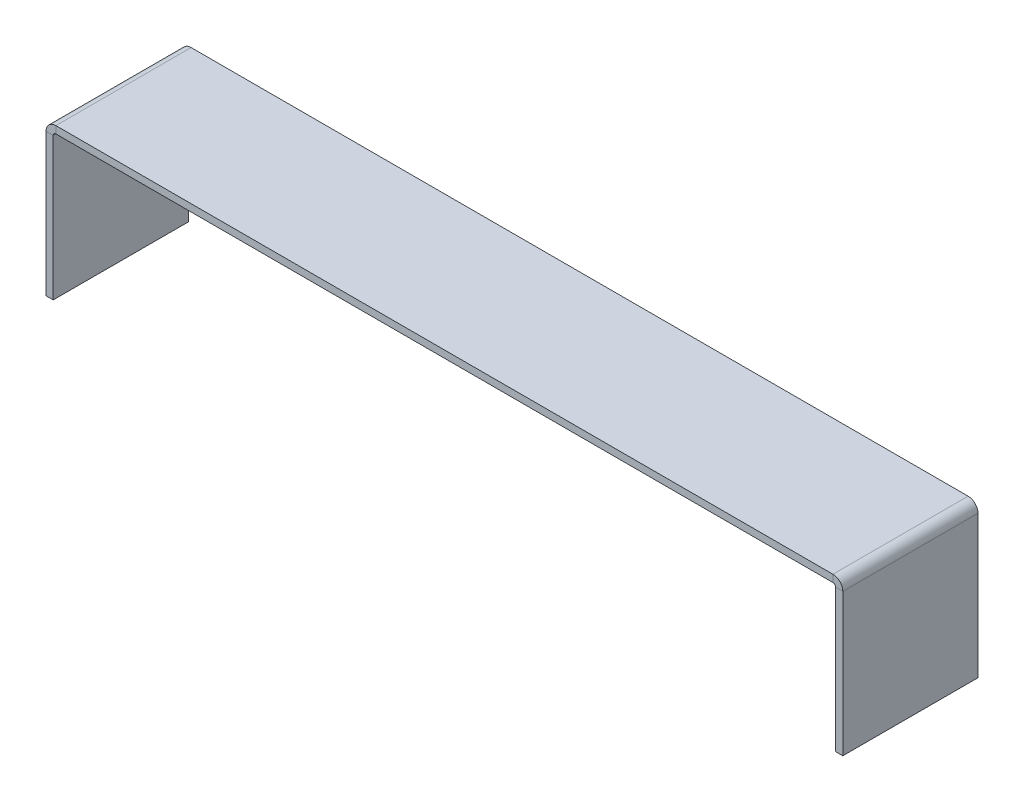
from build123d import *

# Parameters (mm, degrees)
SKETCH_1_W             = 37.5
SKETCH_1_H             = 2
SM_BASE_FLANGE_1_DEPTH = 150
OTHER_START            = -18.75
OTHER_1_DEPTH          = 37.5
OTHER_1_2_DEPTH        = 37.5


# Read off the part's stored shape, not the designer's step: 绘制的折弯1
# Sheet-metal steps are written as plain solids
with BuildPart() as part:
    # Sketch 1 → 基体-法兰1 (new, symmetric)
    with BuildSketch(Plane(origin=(0, 0, 0), x_dir=(0, 0, -1), z_dir=(1, 0, 0))):
        with Locations((0, -1)):
            Rectangle(SKETCH_1_W, SKETCH_1_H)
    extrude(amount=SM_BASE_FLANGE_1_DEPTH, both=True)

    # Other 1 outline → Other 1 (cut)
    with BuildSketch(Plane.XY.offset(OTHER_START)):
        with BuildLine():
            ThreePointArc((-110.399002398, -2), (-109.417667209, -0.556604688), (-107.7634, 0))
            Line((-107.7634, 0), (-150, 0))
            Line((-150, 0), (-150, -2))
            Line((-150, -2), (-110.399002398, -2))
        make_face()
        with BuildLine():
            Line((150, 0), (107.7634, 0))
            ThreePointArc((107.7634, 0), (109.417667209, -0.556604688), (110.399002398, -2))
            Line((110.399002398, -2), (150, -2))
            Line((150, -2), (150, 0))
        make_face()
    extrude(amount=OTHER_1_DEPTH, mode=Mode.SUBTRACT)

    # Other 1 2 outline → Other 1 2 (add)
    with BuildSketch(Plane.XY.offset(OTHER_START)):
        with BuildLine():
            Line((-107.7634, -2), (-110.399002398, -2))
            ThreePointArc((-110.399002398, -2), (-110.474633029, -2.364854094), (-110.5, -2.7366))
            Line((-110.5, -2.7366), (-110.5, -42.245355099))
            Line((-110.5, -42.245355099), (-108.5, -42.245355099))
            Line((-108.5, -42.245355099), (-108.5, -2.7366))
            ThreePointArc((-108.5, -2.7366), (-108.284254855, -2.215745145), (-107.7634, -2))
        make_face()
        with BuildLine():
            ThreePointArc((110.5, -2.7366), (110.474633029, -2.364854094), (110.399002398, -2))
            Line((110.399002398, -2), (107.7634, -2))
            ThreePointArc((107.7634, -2), (108.284254855, -2.215745145), (108.5, -2.7366))
            Line((108.5, -2.7366), (108.5, -42.245355099))
            Line((108.5, -42.245355099), (110.5, -42.245355099))
            Line((110.5, -42.245355099), (110.5, -2.7366))
        make_face()
    extrude(amount=OTHER_1_2_DEPTH)


solid = part.part
